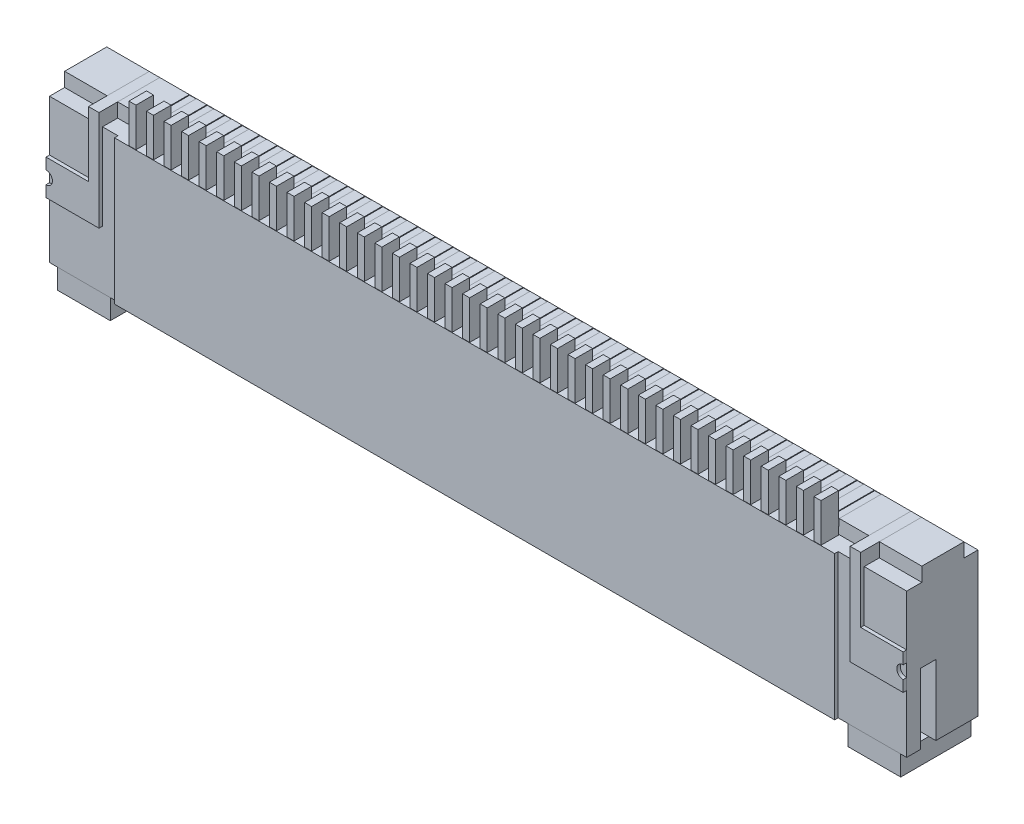
from build123d import *

# Parameters (mm, degrees)
ESBO_O1_W                 = 24.4
ESBO_O1_H                 = 4.5
RESSALTO_EXTRUS_O1_DEPTH  = 2.13
ESBO_O2_OUTSIDE_W         = 31.38
ESBO_O2_OUTSIDE_H         = 11.48
ESBO_O2_OUTSIDE_W_2       = 20.5
ESBO_O2_OUTSIDE_H_2       = 4.5
CORTE_EXTRUS_O1_DEPTH     = 0.1
CORTE_EXTRUS_O2_DEPTH     = 1.53
ESBO_O4_W                 = 0.43
ESBO_O4_H                 = 2
CORTE_EXTRUS_O3_DEPTH     = 25.595922426
ESBO_O5_W                 = 0.6
ESBO_O5_H                 = 1.7
RESSALTO_EXTRUS_O2_DEPTH  = 0.3
ESBO_O6_R                 = 0.2
CORTE_EXTRUS_O4_DEPTH     = 2
RESSALTO_EXTRUS_O3_START  = -0.03
RESSALTO_EXTRUS_O3_DEPTH  = 2
ESBO_O8_W                 = 20.674360077
ESBO_O8_H                 = 4.5
CORTE_EXTRUS_O5_DEPTH     = 13.869611494
ESBO_O10_W                = 21
ESBO_O10_H                = 1.4
CORTE_EXTRUS_O6_DEPTH     = 0.65
ESBO_O11_W                = 21
ESBO_O11_H                = 1.4
CORTE_EXTRUS_O7_DEPTH     = 14.393539487
RESSALTO_EXTRUS_O4_REACH  = 14.792
RESSALTO_EXTRUS_O4_START  = 0.03
ESBO_O12_W                = 0.9
ESBO_O12_H                = 1.85
ESBO_O13_W                = 20.9
ESBO_O13_H                = 0.3
RESSALTO_EXTRUS_O5_DEPTH  = 0.6
ESBO_O14_W                = 0.2
ESBO_O14_H                = 1.5
RESSALTO_EXTRUS_O6_DEPTH  = 0.5
PADR_O_LINEAR1_COUNT      = 40
PADR_O_LINEAR1_PITCH      = 0.5
RESSALTO_EXTRUS_O8_START  = -0.03
ESBO_O16_W                = 0.2
ESBO_O16_H                = 1.5
RESSALTO_EXTRUS_O8_DEPTH  = 0.5
ESBO_O17_W                = 0.8
ESBO_O17_H                = 0.8
ESBO_O17_W_2              = 0.86
CORTE_EXTRUS_O8_DEPTH     = 25.741602616
ESBO_O20_W                = 0.3
ESBO_O20_H                = 0.3
CORTE_EXTRUS_O9_DEPTH     = 10
ESBO_O19_W                = 1.209154669
ESBO_O19_H                = 1
RESSALTO_EXTRUS_O9_DEPTH  = 0.1
ESBO_O21_W                = 0.3
ESBO_O21_H                = 0.4
RESSALTO_EXTRUS_O10_DEPTH = 0.43
ESBO_O22_W                = 0.3
ESBO_O22_H                = 0.3
RESSALTO_EXTRUS_O11_DEPTH = 1.2
ESBO_O23_R                = 0.182878676
CORTE_EXTRUS_O10_DEPTH    = 10
RESSALTO_EXTRUS_O12_START = -0.01
ESBO_O24_W                = 0.2
ESBO_O24_H                = 1.1
RESSALTO_EXTRUS_O12_DEPTH = 0.5
PADR_O_LINEAR2_COUNT      = 40
PADR_O_LINEAR2_PITCH      = 0.5
ESBO_O25_W                = 0.2
ESBO_O25_H                = 1.22
CORTE_EXTRUS_O11_DEPTH    = 0.2
PADR_O_LINEAR3_COUNT      = 40
PADR_O_LINEAR3_PITCH      = 0.5
ESBO_O27_W                = 0.18
ESBO_O27_H                = 0.18
RESSALTO_EXTRUS_O14_DEPTH = 1.22
PADR_O_LINEAR4_COUNT      = 40
PADR_O_LINEAR4_PITCH      = 0.5


with BuildPart() as part:
    # Esboço1 → Ressalto-extrusão1 (new body)
    with BuildSketch(Plane.XY):
        Rectangle(ESBO_O1_W, ESBO_O1_H)
    extrude(amount=RESSALTO_EXTRUS_O1_DEPTH)

    # Esboço2 outside → Corte-extrusão1 (cut)
    with BuildSketch(Plane.XY.offset(2.13)):
        Rectangle(ESBO_O2_OUTSIDE_W, ESBO_O2_OUTSIDE_H)
        Rectangle(ESBO_O2_OUTSIDE_W_2, ESBO_O2_OUTSIDE_H_2, mode=Mode.SUBTRACT)
    extrude(amount=-CORTE_EXTRUS_O1_DEPTH, mode=Mode.SUBTRACT)

    # Esboço3 → Corte-extrusão2 (cut)
    with BuildSketch(Plane(origin=(0, 0, 0), x_dir=(-1, 0, 0), z_dir=(0, 0, -1))):
        Polygon((-11.5, -2.25), (-11.5, -0.25), (-10.3, -0.25), (-10.3, -0.75), (10.3, -0.75), (10.3, -0.25), (11.5, -0.25), (11.5, -2.25), align=None)
    extrude(amount=-CORTE_EXTRUS_O2_DEPTH, mode=Mode.SUBTRACT)

    # Esboço4 → Corte-extrusão3 (cut, through all)
    with BuildSketch(Plane.ZY.offset(12.2)):
        with Locations((1.415, -1.25)):
            Rectangle(ESBO_O4_W, ESBO_O4_H)
    extrude(amount=-CORTE_EXTRUS_O3_DEPTH, mode=Mode.SUBTRACT)

    # Esboço5 → Ressalto-extrusão2 (add)
    with BuildSketch(Plane(origin=(0, 0, 1.63), x_dir=(-1, 0, 0), z_dir=(0, 0, -1))):
        with Locations((10.9, -1.4)):
            Rectangle(ESBO_O5_W, ESBO_O5_H)
        with Locations((-10.9, -1.4)):
            Rectangle(ESBO_O5_W, ESBO_O5_H)
    extrude(amount=RESSALTO_EXTRUS_O2_DEPTH)

    # Esboço6 → Corte-extrusão4 (cut)
    with BuildSketch(Plane.XZ.offset(2.25)):
        with Locations((-11.5, 0.6)):
            Circle(ESBO_O6_R)
        with Locations((11.5, 0.6)):
            Circle(ESBO_O6_R)
    extrude(amount=-CORTE_EXTRUS_O4_DEPTH, mode=Mode.SUBTRACT)

    # Esboço17 → Corte-extrusão8 (cut, through all)
    with BuildSketch(Plane(origin=(12.2, 0, 0), x_dir=(0, 0, -1), z_dir=(1, 0, 0))):
        with Locations((0, 2.25)):
            Rectangle(ESBO_O17_W, ESBO_O17_H)
        with Locations((-2.03, 2.25)):
            Rectangle(ESBO_O17_W_2, ESBO_O17_H)
    extrude(amount=-CORTE_EXTRUS_O8_DEPTH, mode=Mode.SUBTRACT)

    # Esboço20 → Corte-extrusão9 (cut)
    with BuildSketch(Plane.XY.offset(1.6)):
        with Locations((-10.840845331, 2.1)):
            Rectangle(ESBO_O20_W, ESBO_O20_H)
    corte_extrus_o9 = extrude(amount=-CORTE_EXTRUS_O9_DEPTH, mode=Mode.SUBTRACT)

    # Espelhar1: Corte-extrusão9 across plane
    add(corte_extrus_o9.mirror(Plane(origin=(0, 0, 0), x_dir=(0, 0, 1), z_dir=(1, 0, 0))), mode=Mode.SUBTRACT)

    # Esboço24 → Ressalto-extrusão12 (add)
    with BuildSketch(Plane.XY.offset(2.13).offset(RESSALTO_EXTRUS_O12_START)):
        with Locations((-9.75, 2.4)):
            Rectangle(ESBO_O24_W, ESBO_O24_H)
    ressalto_extrus_o12 = extrude(amount=-RESSALTO_EXTRUS_O12_DEPTH)

    # Padrão linear2: Ressalto-extrusão12 ×40
    with Locations(*[(i * PADR_O_LINEAR2_PITCH, 0, 0) for i in range(1, PADR_O_LINEAR2_COUNT)]):
        add(ressalto_extrus_o12)

    # Esboço25 → Corte-extrusão11 (cut)
    with BuildSketch(Plane(origin=(0, 2.25, 0), x_dir=(1, 0, 0), z_dir=(0, 1, 0))):
        with Locations((-9.75, -1.01)):
            Rectangle(ESBO_O25_W, ESBO_O25_H)
    corte_extrus_o11 = extrude(amount=-CORTE_EXTRUS_O11_DEPTH, mode=Mode.SUBTRACT)

    # Padrão linear3: Corte-extrusão11 ×40
    with Locations(*[(i * PADR_O_LINEAR3_PITCH, 0, 0) for i in range(1, PADR_O_LINEAR3_COUNT)]):
        add(corte_extrus_o11, mode=Mode.SUBTRACT)

    # Esboço27 → Ressalto-extrusão14 (add)
    with BuildSketch(Plane(origin=(0, 0, 1.62), x_dir=(-1, 0, 0), z_dir=(0, 0, -1))):
        with Locations((9.75, 2.15)):
            Rectangle(ESBO_O27_W, ESBO_O27_H)
    ressalto_extrus_o14 = extrude(amount=RESSALTO_EXTRUS_O14_DEPTH)

    # Padrão linear4: Ressalto-extrusão14 ×40
    with Locations(*[(i * PADR_O_LINEAR4_PITCH, 0, 0) for i in range(1, PADR_O_LINEAR4_COUNT)]):
        add(ressalto_extrus_o14)


with BuildPart() as body_2:
    # Esboço7 → Ressalto-extrusão3 (new body)
    with BuildSketch(Plane.XY.offset(2.03).offset(RESSALTO_EXTRUS_O3_START)):
        Polygon((0, 2.25), (-10.25, 2.25), (-10.25, -2.25), (-12, -2.25), (-12, -2.85), (-10.5, -2.85), (-10, -3.5), (10, -3.5), (10.5, -2.85), (12, -2.85), (12, -2.25), (10.25, -2.25), (10.25, 2.25), align=None)
    extrude(amount=-RESSALTO_EXTRUS_O3_DEPTH)

    # Esboço8 → Corte-extrusão5 (cut, through all)
    with BuildSketch(Plane(origin=(0, 0, 0), x_dir=(-1, 0, 0), z_dir=(0, 0, -1))):
        with Locations((0.087180039, 0)):
            Rectangle(ESBO_O8_W, ESBO_O8_H)
    extrude(amount=-CORTE_EXTRUS_O5_DEPTH, mode=Mode.SUBTRACT)

    # Esboço10 → Corte-extrusão6 (cut)
    with BuildSketch(Plane.XZ.offset(3.5)):
        with Locations((0, 1.3)):
            Rectangle(ESBO_O10_W, ESBO_O10_H)
    extrude(amount=-CORTE_EXTRUS_O6_DEPTH, mode=Mode.SUBTRACT)

    # Esboço11 → Corte-extrusão7 (cut, through all)
    with BuildSketch(Plane.XZ.offset(2.85)):
        with Locations((0, 1.3)):
            Rectangle(ESBO_O11_W, ESBO_O11_H)
    extrude(amount=-CORTE_EXTRUS_O7_DEPTH, mode=Mode.SUBTRACT)

    # Ressalto-extrusão4: up to this face of the body (flat: up to its plane)
    ressalto_extrus_o4_end = Plane(body_2.part.faces().sort_by_distance((0, -2.849113315, 0))[0])
    # Esboço12 → Ressalto-extrusão4 (add, up to the picked face)
    with BuildSketch(Plane(origin=(0, 0, 1.33), x_dir=(-1, 0, 0), z_dir=(0, 0, -1)).offset(RESSALTO_EXTRUS_O4_START), mode=Mode.PRIVATE) as ressalto_extrus_o4_sk1:
        with Locations((-10.9, -1.325)):
            Rectangle(ESBO_O12_W, ESBO_O12_H)
    ressalto_extrus_o4_tool1 = split(extrude(ressalto_extrus_o4_sk1.sketch, amount=RESSALTO_EXTRUS_O4_REACH, mode=Mode.PRIVATE), bisect_by=ressalto_extrus_o4_end, keep=Keep.BOTH, mode=Mode.PRIVATE)
    # Esboço12 → Ressalto-extrusão4 (add, up to the picked face)
    with BuildSketch(Plane(origin=(0, 0, 1.33), x_dir=(-1, 0, 0), z_dir=(0, 0, -1)).offset(RESSALTO_EXTRUS_O4_START), mode=Mode.PRIVATE) as ressalto_extrus_o4_sk2:
        with Locations((10.9, -1.325)):
            Rectangle(ESBO_O12_W, ESBO_O12_H)
    ressalto_extrus_o4_tool2 = split(extrude(ressalto_extrus_o4_sk2.sketch, amount=RESSALTO_EXTRUS_O4_REACH, mode=Mode.PRIVATE), bisect_by=ressalto_extrus_o4_end, keep=Keep.BOTH, mode=Mode.PRIVATE)
    add(ressalto_extrus_o4_tool1.solids().sort_by(Axis((10.9, -1.325, 1.3), (0, 0, -1)))[0])
    add(ressalto_extrus_o4_tool2.solids().sort_by(Axis((-10.9, -1.325, 1.3), (0, 0, -1)))[0])

    # Esboço13 → Ressalto-extrusão5 (add)
    with BuildSketch(Plane(origin=(0, 0, 0), x_dir=(-1, 0, 0), z_dir=(0, 0, -1))):
        with Locations((0, -2.1)):
            Rectangle(ESBO_O13_W, ESBO_O13_H)
    extrude(amount=-RESSALTO_EXTRUS_O5_DEPTH)

    # Esboço16 → Ressalto-extrusão8 (add)
    with BuildSketch(Plane(origin=(0, 0, 0), x_dir=(-1, 0, 0), z_dir=(0, 0, -1)).offset(RESSALTO_EXTRUS_O8_START)):
        with Locations((-9.75, -1.5)):
            Rectangle(ESBO_O16_W, ESBO_O16_H)
        with Locations((-9.25, -1.5)):
            Rectangle(ESBO_O16_W, ESBO_O16_H)
        with Locations((-8.75, -1.5)):
            Rectangle(ESBO_O16_W, ESBO_O16_H)
        with Locations((-8.25, -1.5)):
            Rectangle(ESBO_O16_W, ESBO_O16_H)
        with Locations((-7.75, -1.5)):
            Rectangle(ESBO_O16_W, ESBO_O16_H)
        with Locations((-7.25, -1.5)):
            Rectangle(ESBO_O16_W, ESBO_O16_H)
        with Locations((-6.75, -1.5)):
            Rectangle(ESBO_O16_W, ESBO_O16_H)
        with Locations((-6.25, -1.5)):
            Rectangle(ESBO_O16_W, ESBO_O16_H)
        with Locations((-5.75, -1.5)):
            Rectangle(ESBO_O16_W, ESBO_O16_H)
        with Locations((-5.25, -1.5)):
            Rectangle(ESBO_O16_W, ESBO_O16_H)
        with Locations((-4.75, -1.5)):
            Rectangle(ESBO_O16_W, ESBO_O16_H)
        with Locations((-4.25, -1.5)):
            Rectangle(ESBO_O16_W, ESBO_O16_H)
        with Locations((-3.75, -1.5)):
            Rectangle(ESBO_O16_W, ESBO_O16_H)
        with Locations((-3.25, -1.5)):
            Rectangle(ESBO_O16_W, ESBO_O16_H)
        with Locations((-2.75, -1.5)):
            Rectangle(ESBO_O16_W, ESBO_O16_H)
        with Locations((-2.25, -1.5)):
            Rectangle(ESBO_O16_W, ESBO_O16_H)
        with Locations((-1.75, -1.5)):
            Rectangle(ESBO_O16_W, ESBO_O16_H)
        with Locations((-1.25, -1.5)):
            Rectangle(ESBO_O16_W, ESBO_O16_H)
        with Locations((-0.75, -1.5)):
            Rectangle(ESBO_O16_W, ESBO_O16_H)
        with Locations((-0.25, -1.5)):
            Rectangle(ESBO_O16_W, ESBO_O16_H)
        with Locations((0.25, -1.5)):
            Rectangle(ESBO_O16_W, ESBO_O16_H)
        with Locations((0.75, -1.5)):
            Rectangle(ESBO_O16_W, ESBO_O16_H)
        with Locations((1.25, -1.5)):
            Rectangle(ESBO_O16_W, ESBO_O16_H)
        with Locations((1.75, -1.5)):
            Rectangle(ESBO_O16_W, ESBO_O16_H)
        with Locations((2.25, -1.5)):
            Rectangle(ESBO_O16_W, ESBO_O16_H)
        with Locations((2.75, -1.5)):
            Rectangle(ESBO_O16_W, ESBO_O16_H)
        with Locations((3.25, -1.5)):
            Rectangle(ESBO_O16_W, ESBO_O16_H)
        with Locations((3.75, -1.5)):
            Rectangle(ESBO_O16_W, ESBO_O16_H)
        with Locations((4.25, -1.5)):
            Rectangle(ESBO_O16_W, ESBO_O16_H)
        with Locations((4.75, -1.5)):
            Rectangle(ESBO_O16_W, ESBO_O16_H)
        with Locations((5.25, -1.5)):
            Rectangle(ESBO_O16_W, ESBO_O16_H)
        with Locations((5.75, -1.5)):
            Rectangle(ESBO_O16_W, ESBO_O16_H)
        with Locations((6.25, -1.5)):
            Rectangle(ESBO_O16_W, ESBO_O16_H)
        with Locations((6.75, -1.5)):
            Rectangle(ESBO_O16_W, ESBO_O16_H)
        with Locations((7.25, -1.5)):
            Rectangle(ESBO_O16_W, ESBO_O16_H)
        with Locations((7.75, -1.5)):
            Rectangle(ESBO_O16_W, ESBO_O16_H)
        with Locations((8.25, -1.5)):
            Rectangle(ESBO_O16_W, ESBO_O16_H)
        with Locations((8.75, -1.5)):
            Rectangle(ESBO_O16_W, ESBO_O16_H)
        with Locations((9.25, -1.5)):
            Rectangle(ESBO_O16_W, ESBO_O16_H)
        with Locations((9.75, -1.5)):
            Rectangle(ESBO_O16_W, ESBO_O16_H)
    extrude(amount=-RESSALTO_EXTRUS_O8_DEPTH)


with BuildPart() as body_3:
    # Esboço14 → Ressalto-extrusão6 (new body)
    with BuildSketch(Plane(origin=(0, 0, 1.63), x_dir=(-1, 0, 0), z_dir=(0, 0, -1))):
        with Locations((-9.75, -1.5)):
            Rectangle(ESBO_O14_W, ESBO_O14_H)
    extrude(amount=RESSALTO_EXTRUS_O6_DEPTH)


with BuildPart() as padr_o_linear1_1:
    # Padrão linear1: pattern copy
    add(body_3.part.moved(Location(Vector(-1, 0, 0) * (1 * PADR_O_LINEAR1_PITCH))))


with BuildPart() as padr_o_linear1_2:
    # Padrão linear1: pattern copy
    add(body_3.part.moved(Location(Vector(-1, 0, 0) * (2 * PADR_O_LINEAR1_PITCH))))


with BuildPart() as padr_o_linear1_3:
    # Padrão linear1: pattern copy
    add(body_3.part.moved(Location(Vector(-1, 0, 0) * (3 * PADR_O_LINEAR1_PITCH))))


with BuildPart() as padr_o_linear1_4:
    # Padrão linear1: pattern copy
    add(body_3.part.moved(Location(Vector(-1, 0, 0) * (4 * PADR_O_LINEAR1_PITCH))))


with BuildPart() as padr_o_linear1_5:
    # Padrão linear1: pattern copy
    add(body_3.part.moved(Location(Vector(-1, 0, 0) * (5 * PADR_O_LINEAR1_PITCH))))


with BuildPart() as padr_o_linear1_6:
    # Padrão linear1: pattern copy
    add(body_3.part.moved(Location(Vector(-1, 0, 0) * (6 * PADR_O_LINEAR1_PITCH))))


with BuildPart() as padr_o_linear1_7:
    # Padrão linear1: pattern copy
    add(body_3.part.moved(Location(Vector(-1, 0, 0) * (7 * PADR_O_LINEAR1_PITCH))))


with BuildPart() as padr_o_linear1_8:
    # Padrão linear1: pattern copy
    add(body_3.part.moved(Location(Vector(-1, 0, 0) * (8 * PADR_O_LINEAR1_PITCH))))


with BuildPart() as padr_o_linear1_9:
    # Padrão linear1: pattern copy
    add(body_3.part.moved(Location(Vector(-1, 0, 0) * (9 * PADR_O_LINEAR1_PITCH))))


with BuildPart() as padr_o_linear1_10:
    # Padrão linear1: pattern copy
    add(body_3.part.moved(Location(Vector(-1, 0, 0) * (10 * PADR_O_LINEAR1_PITCH))))


with BuildPart() as padr_o_linear1_11:
    # Padrão linear1: pattern copy
    add(body_3.part.moved(Location(Vector(-1, 0, 0) * (11 * PADR_O_LINEAR1_PITCH))))


with BuildPart() as padr_o_linear1_12:
    # Padrão linear1: pattern copy
    add(body_3.part.moved(Location(Vector(-1, 0, 0) * (12 * PADR_O_LINEAR1_PITCH))))


with BuildPart() as padr_o_linear1_13:
    # Padrão linear1: pattern copy
    add(body_3.part.moved(Location(Vector(-1, 0, 0) * (13 * PADR_O_LINEAR1_PITCH))))


with BuildPart() as padr_o_linear1_14:
    # Padrão linear1: pattern copy
    add(body_3.part.moved(Location(Vector(-1, 0, 0) * (14 * PADR_O_LINEAR1_PITCH))))


with BuildPart() as padr_o_linear1_15:
    # Padrão linear1: pattern copy
    add(body_3.part.moved(Location(Vector(-1, 0, 0) * (15 * PADR_O_LINEAR1_PITCH))))


with BuildPart() as padr_o_linear1_16:
    # Padrão linear1: pattern copy
    add(body_3.part.moved(Location(Vector(-1, 0, 0) * (16 * PADR_O_LINEAR1_PITCH))))


with BuildPart() as padr_o_linear1_17:
    # Padrão linear1: pattern copy
    add(body_3.part.moved(Location(Vector(-1, 0, 0) * (17 * PADR_O_LINEAR1_PITCH))))


with BuildPart() as padr_o_linear1_18:
    # Padrão linear1: pattern copy
    add(body_3.part.moved(Location(Vector(-1, 0, 0) * (18 * PADR_O_LINEAR1_PITCH))))


with BuildPart() as padr_o_linear1_19:
    # Padrão linear1: pattern copy
    add(body_3.part.moved(Location(Vector(-1, 0, 0) * (19 * PADR_O_LINEAR1_PITCH))))


with BuildPart() as padr_o_linear1_20:
    # Padrão linear1: pattern copy
    add(body_3.part.moved(Location(Vector(-1, 0, 0) * (20 * PADR_O_LINEAR1_PITCH))))


with BuildPart() as padr_o_linear1_21:
    # Padrão linear1: pattern copy
    add(body_3.part.moved(Location(Vector(-1, 0, 0) * (21 * PADR_O_LINEAR1_PITCH))))


with BuildPart() as padr_o_linear1_22:
    # Padrão linear1: pattern copy
    add(body_3.part.moved(Location(Vector(-1, 0, 0) * (22 * PADR_O_LINEAR1_PITCH))))


with BuildPart() as padr_o_linear1_23:
    # Padrão linear1: pattern copy
    add(body_3.part.moved(Location(Vector(-1, 0, 0) * (23 * PADR_O_LINEAR1_PITCH))))


with BuildPart() as padr_o_linear1_24:
    # Padrão linear1: pattern copy
    add(body_3.part.moved(Location(Vector(-1, 0, 0) * (24 * PADR_O_LINEAR1_PITCH))))


with BuildPart() as padr_o_linear1_25:
    # Padrão linear1: pattern copy
    add(body_3.part.moved(Location(Vector(-1, 0, 0) * (25 * PADR_O_LINEAR1_PITCH))))


with BuildPart() as padr_o_linear1_26:
    # Padrão linear1: pattern copy
    add(body_3.part.moved(Location(Vector(-1, 0, 0) * (26 * PADR_O_LINEAR1_PITCH))))


with BuildPart() as padr_o_linear1_27:
    # Padrão linear1: pattern copy
    add(body_3.part.moved(Location(Vector(-1, 0, 0) * (27 * PADR_O_LINEAR1_PITCH))))


with BuildPart() as padr_o_linear1_28:
    # Padrão linear1: pattern copy
    add(body_3.part.moved(Location(Vector(-1, 0, 0) * (28 * PADR_O_LINEAR1_PITCH))))


with BuildPart() as padr_o_linear1_29:
    # Padrão linear1: pattern copy
    add(body_3.part.moved(Location(Vector(-1, 0, 0) * (29 * PADR_O_LINEAR1_PITCH))))


with BuildPart() as padr_o_linear1_30:
    # Padrão linear1: pattern copy
    add(body_3.part.moved(Location(Vector(-1, 0, 0) * (30 * PADR_O_LINEAR1_PITCH))))


with BuildPart() as padr_o_linear1_31:
    # Padrão linear1: pattern copy
    add(body_3.part.moved(Location(Vector(-1, 0, 0) * (31 * PADR_O_LINEAR1_PITCH))))


with BuildPart() as padr_o_linear1_32:
    # Padrão linear1: pattern copy
    add(body_3.part.moved(Location(Vector(-1, 0, 0) * (32 * PADR_O_LINEAR1_PITCH))))


with BuildPart() as padr_o_linear1_33:
    # Padrão linear1: pattern copy
    add(body_3.part.moved(Location(Vector(-1, 0, 0) * (33 * PADR_O_LINEAR1_PITCH))))


with BuildPart() as padr_o_linear1_34:
    # Padrão linear1: pattern copy
    add(body_3.part.moved(Location(Vector(-1, 0, 0) * (34 * PADR_O_LINEAR1_PITCH))))


with BuildPart() as padr_o_linear1_35:
    # Padrão linear1: pattern copy
    add(body_3.part.moved(Location(Vector(-1, 0, 0) * (35 * PADR_O_LINEAR1_PITCH))))


with BuildPart() as padr_o_linear1_36:
    # Padrão linear1: pattern copy
    add(body_3.part.moved(Location(Vector(-1, 0, 0) * (36 * PADR_O_LINEAR1_PITCH))))


with BuildPart() as padr_o_linear1_37:
    # Padrão linear1: pattern copy
    add(body_3.part.moved(Location(Vector(-1, 0, 0) * (37 * PADR_O_LINEAR1_PITCH))))


with BuildPart() as padr_o_linear1_38:
    # Padrão linear1: pattern copy
    add(body_3.part.moved(Location(Vector(-1, 0, 0) * (38 * PADR_O_LINEAR1_PITCH))))


with BuildPart() as padr_o_linear1_39:
    # Padrão linear1: pattern copy
    add(body_3.part.moved(Location(Vector(-1, 0, 0) * (39 * PADR_O_LINEAR1_PITCH))))


with BuildPart() as body_43:
    # Esboço19 → Ressalto-extrusão9 (new body)
    with BuildSketch(Plane.XY.offset(2.13)):
        with Locations((-11.595422666, -0.1)):
            Rectangle(ESBO_O19_W, ESBO_O19_H)
        Polygon((-10.990845331, 2.25), (-10.990845331, 0.4), (-10.990845331, -0.6), (-10.690845331, -0.6), (-10.690845331, 2.25), align=None)
    extrude(amount=-RESSALTO_EXTRUS_O9_DEPTH)

    # Esboço21 → Ressalto-extrusão10 (add)
    with BuildSketch(Plane(origin=(0, 0, 2.03), x_dir=(-1, 0, 0), z_dir=(0, 0, -1))):
        with Locations((10.840845331, 2.05)):
            Rectangle(ESBO_O21_W, ESBO_O21_H)
    extrude(amount=RESSALTO_EXTRUS_O10_DEPTH)

    # Esboço22 → Ressalto-extrusão11 (add)
    with BuildSketch(Plane(origin=(0, 0, 1.6), x_dir=(-1, 0, 0), z_dir=(0, 0, -1))):
        with Locations((10.840845331, 2.1)):
            Rectangle(ESBO_O22_W, ESBO_O22_H)
    extrude(amount=RESSALTO_EXTRUS_O11_DEPTH)

    # Esboço23 → Corte-extrusão10 (cut)
    with BuildSketch(Plane.XY.offset(2.13)):
        with Locations((-12.2, -0.1)):
            Circle(ESBO_O23_R)
    extrude(amount=-CORTE_EXTRUS_O10_DEPTH, mode=Mode.SUBTRACT)


with BuildPart() as body_44:
    # Espelhar2: mirrored copy
    add(body_43.part.mirror(Plane(origin=(0, 0, 0), x_dir=(0, 0, 1), z_dir=(1, 0, 0))))


solid = Compound([part.part, body_2.part, body_3.part, padr_o_linear1_1.part, padr_o_linear1_2.part, padr_o_linear1_3.part, padr_o_linear1_4.part, padr_o_linear1_5.part, padr_o_linear1_6.part, padr_o_linear1_7.part, padr_o_linear1_8.part, padr_o_linear1_9.part, padr_o_linear1_10.part, padr_o_linear1_11.part, padr_o_linear1_12.part, padr_o_linear1_13.part, padr_o_linear1_14.part, padr_o_linear1_15.part, padr_o_linear1_16.part, padr_o_linear1_17.part, padr_o_linear1_18.part, padr_o_linear1_19.part, padr_o_linear1_20.part, padr_o_linear1_21.part, padr_o_linear1_22.part, padr_o_linear1_23.part, padr_o_linear1_24.part, padr_o_linear1_25.part, padr_o_linear1_26.part, padr_o_linear1_27.part, padr_o_linear1_28.part, padr_o_linear1_29.part, padr_o_linear1_30.part, padr_o_linear1_31.part, padr_o_linear1_32.part, padr_o_linear1_33.part, padr_o_linear1_34.part, padr_o_linear1_35.part, padr_o_linear1_36.part, padr_o_linear1_37.part, padr_o_linear1_38.part, padr_o_linear1_39.part, body_43.part, body_44.part])
